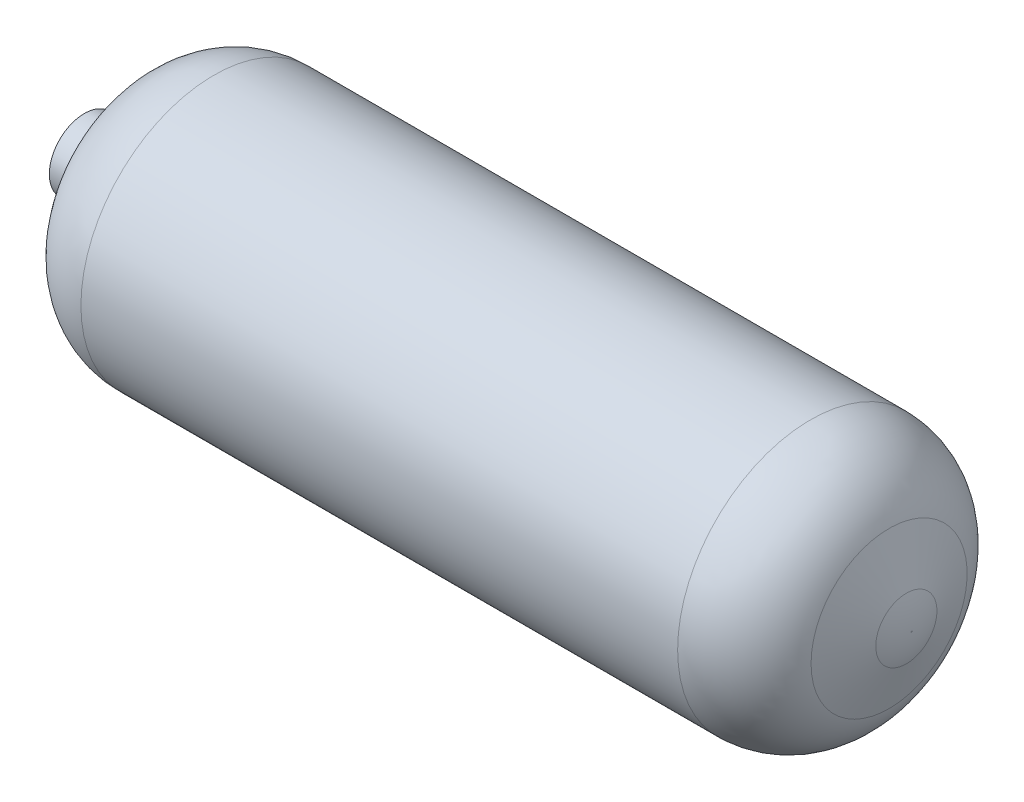
from build123d import *

# Parameters (mm, degrees)
SCALE1_SCALE = 649.76746201


with BuildPart() as part:
    # Sketch1 → Revolve2 (revolve)
    with BuildSketch(Plane.XY):
        with BuildLine():
            Line((0.30325, 0.129), (-0.275595218, 0.129))
            ThreePointArc((-0.275595218, 0.129), (-0.3184401, 0.116916493), (-0.348657753, 0.084227221))
            Line((-0.348657753, 0.084227221), (-0.372858421, 0.036730735))
            ThreePointArc((-0.372858421, 0.036730735), (-0.374701425, 0.034736985), (-0.377314576, 0.034))
            Line((-0.377314576, 0.034), (-0.40125, 0.034))
            Line((-0.40125, 0.034), (-0.40125, 0))
            Line((-0.40125, 0), (0.40125, 0))
            Line((0.40125, 0), (0.40125, 0.000587576))
            ThreePointArc((0.40125, 0.000587576), (0.399958659, 0.015347671), (0.396123873, 0.029659288))
            Line((0.396123873, 0.029659288), (0.379365102, 0.075703632))
            ThreePointArc((0.379365102, 0.075703632), (0.349709691, 0.114351316), (0.30325, 0.129))
        make_face()
    revolve(axis=Axis((-0.40125, 0, 0), (1, 0, 0)))


with BuildPart() as part_1:
    # Scale1: scaled about (0, 0, 0)
    add(part.part.scale(SCALE1_SCALE))


solid = part_1.part
